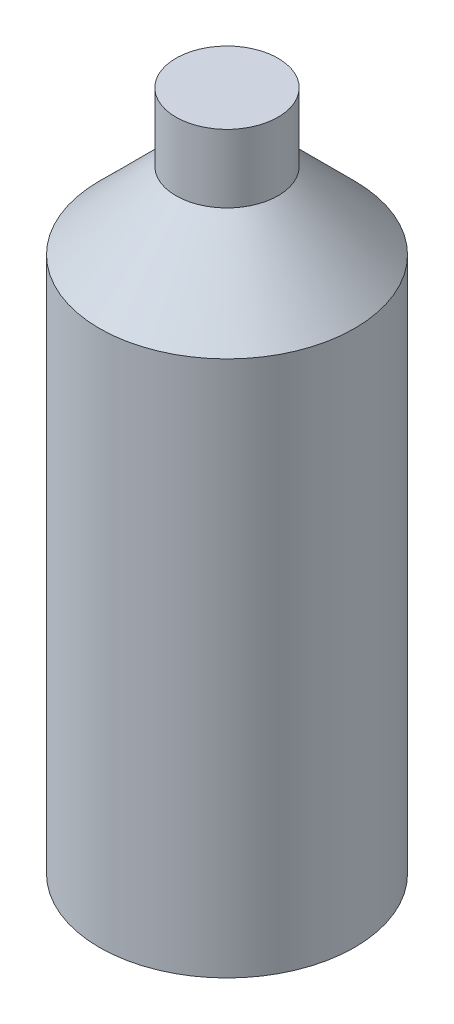
from build123d import *

# Parameters (mm, degrees)
ESQUISSE1_R         = 37.5
EXTRUSION1_DEPTH    = 200
ESQUISSE2_OUTSIDE_W = 122.276
ESQUISSE2_OUTSIDE_H = 122.276
ESQUISSE2_OUTSIDE_R = 15
EXTRUSION2_DEPTH    = 20
CHANFREIN1_SIZE     = 22.5


with BuildPart() as part:
    # Esquisse1 → Extrusion1 (new body)
    with BuildSketch(Plane(origin=(0, 0, 0), x_dir=(1, 0, 0), z_dir=(0, 1, 0))):
        with Locations(Location((0, 0, 0), (0, 0, 270))):
            Circle(ESQUISSE1_R)
    extrude(amount=EXTRUSION1_DEPTH)

    # Esquisse2 outside → Extrusion2 (cut)
    with BuildSketch(Plane(origin=(0, 200, 0), x_dir=(1, 0, 0), z_dir=(0, 1, 0))):
        Rectangle(ESQUISSE2_OUTSIDE_W, ESQUISSE2_OUTSIDE_H)
        with Locations(Location((0, 0, 0), (0, 0, 270))):
            Circle(ESQUISSE2_OUTSIDE_R, mode=Mode.SUBTRACT)
    extrude(amount=-EXTRUSION2_DEPTH, mode=Mode.SUBTRACT)

    # Chanfrein1
    chanfrein1_edges = [part.edges().sort_by_distance(p)[0] for p in [
        (0, 180, -37.5),
    ]]
    chamfer(chanfrein1_edges, length=CHANFREIN1_SIZE - 0.0001)  # a hair under: the kernel refuses the full size


solid = part.part
